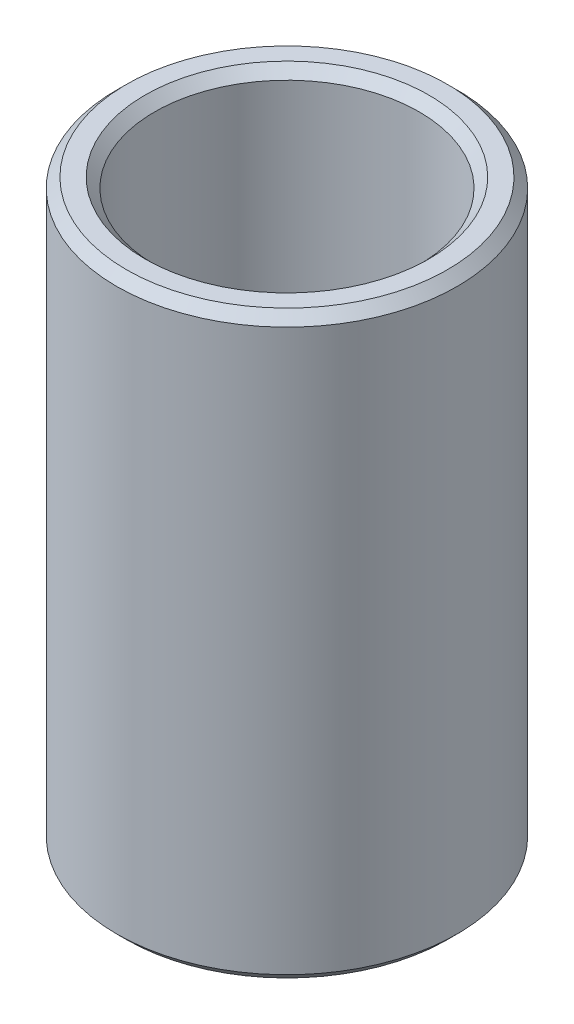
from build123d import *

# Parameters (mm, degrees)
SKETCH1_R           = 30
BOSS_EXTRUDE1_DEPTH = 102.239954513
SKETCH2_R           = 23.315301052
CUT_EXTRUDE1_DEPTH  = 111.69330738
CHAMFER1_SIZE       = 1.706440789


with BuildPart() as part:
    # Sketch1 → Boss-Extrude1 (new body)
    with BuildSketch(Plane(origin=(0, 0, 0), x_dir=(1, 0, 0), z_dir=(0, 1, 0))):
        Circle(SKETCH1_R)
    extrude(amount=BOSS_EXTRUDE1_DEPTH)

    # Sketch2 → Cut-Extrude1 (cut, through all)
    with BuildSketch(Plane(origin=(0, 0, 0), x_dir=(1, 0, 0), z_dir=(0, 1, 0))):
        Circle(SKETCH2_R)
    extrude(amount=CUT_EXTRUDE1_DEPTH, mode=Mode.SUBTRACT)

    # Chamfer1
    chamfer1_edges = [part.edges().sort_by_distance(p)[0] for p in [
        (-23.315301052, 102.239954513, 0),
        (-23.315301052, 0, 0),
        (-30, 0, 0),
        (-30, 102.239954513, 0),
    ]]
    chamfer(chamfer1_edges, length=CHAMFER1_SIZE)


solid = part.part
